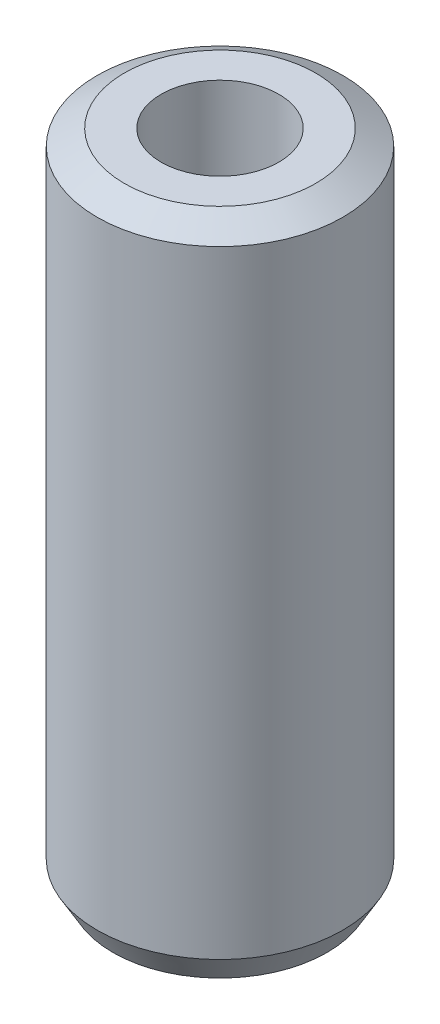
from build123d import *
from OCP.BRepFilletAPI import BRepFilletAPI_MakeChamfer

# Parameters (mm, degrees)
SKETCH1_R           = 40
BOSS_EXTRUDE1_DEPTH = 214.960547986
SKETCH2_R           = 19.167038244
CUT_EXTRUDE1_DEPTH  = 223.279187489
CHAMFER1_SIZE       = 5.105649673
CHAMFER1_SIZE2      = 8.843244639


with BuildPart() as part:
    # Sketch1 → Boss-Extrude1 (new body)
    with BuildSketch(Plane(origin=(0, 0, 0), x_dir=(1, 0, 0), z_dir=(0, 1, 0))):
        Circle(SKETCH1_R)
    extrude(amount=BOSS_EXTRUDE1_DEPTH)

    # Sketch2 → Cut-Extrude1 (cut, through all)
    with BuildSketch(Plane(origin=(0, 0, 0), x_dir=(1, 0, 0), z_dir=(0, 1, 0))):
        Circle(SKETCH2_R)
    extrude(amount=CUT_EXTRUDE1_DEPTH, mode=Mode.SUBTRACT)

    # Chamfer1: one chamfer whose edges measure the first distance from different faces: ONE call of the kernel's chamfer builder (chamfer() names one face for all edges)
    chamfer1_edges_1 = [part.edges().sort_by_distance(p)[0] for p in [
        (-40, 214.960547986, 0),
    ]]
    chamfer1_side_1 = [part.faces().sort_by_distance(p)[0] for p in [
        (-40, 107.480273993, 0),
    ]]
    chamfer1_edges_2 = [part.edges().sort_by_distance(p)[0] for p in [
        (-40, 0, 0),
    ]]
    chamfer1_side_2 = [part.faces().sort_by_distance(p)[0] for p in [
        (-38.86862915, 0, 0),
    ]]
    chamfer1 = BRepFilletAPI_MakeChamfer(part.part.solid().wrapped)
    for e in chamfer1_edges_1:
        chamfer1.Add(CHAMFER1_SIZE, CHAMFER1_SIZE2, e.wrapped, chamfer1_side_1[0].wrapped)  # the first distance lies on this face
    for e in chamfer1_edges_2:
        chamfer1.Add(CHAMFER1_SIZE, CHAMFER1_SIZE2, e.wrapped, chamfer1_side_2[0].wrapped)  # the first distance lies on this face
    add(Compound.cast(chamfer1.Shape()), mode=Mode.REPLACE)


solid = part.part
